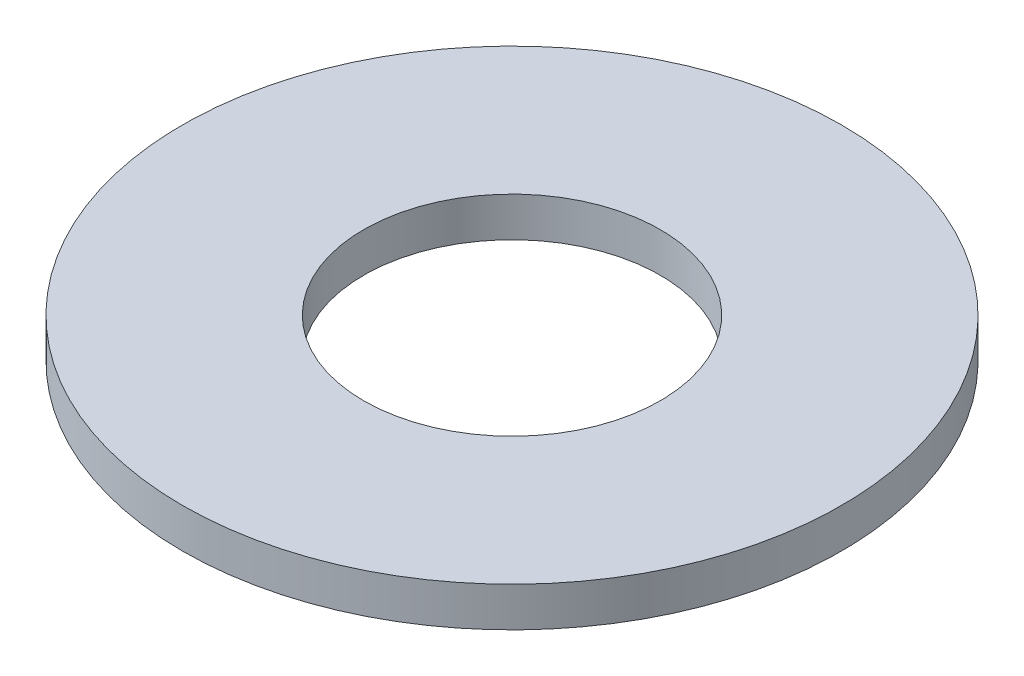
from build123d import *

# Parameters (mm, degrees)
SKETCH1_R           = 50
BOSS_EXTRUDE1_DEPTH = 6
SKETCH2_R           = 22.5
CUT_EXTRUDE1_DEPTH  = 71.964779997


with BuildPart() as part:
    # Sketch1 → Boss-Extrude1 (new body)
    with BuildSketch(Plane(origin=(0, 0, 0), x_dir=(1, 0, 0), z_dir=(0, 1, 0))):
        Circle(SKETCH1_R)
    extrude(amount=BOSS_EXTRUDE1_DEPTH)

    # Sketch2 → Cut-Extrude1 (cut, through all)
    with BuildSketch(Plane(origin=(0, 0, 0), x_dir=(1, 0, 0), z_dir=(0, 1, 0))):
        Circle(SKETCH2_R)
    extrude(amount=CUT_EXTRUDE1_DEPTH, mode=Mode.SUBTRACT)


solid = part.part
